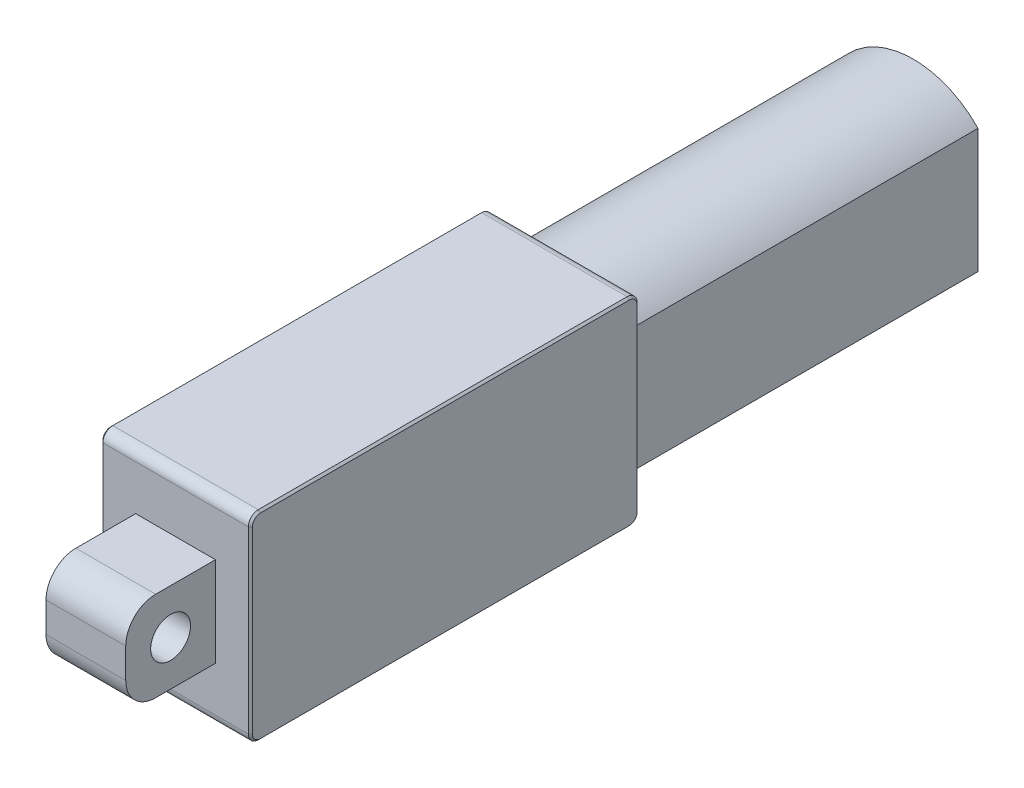
from build123d import *

# Parameters (mm, degrees)
SKETCH_1_R          = 2
EXTRUDE_1_DEPTH     = 8
EXTRUDE_2_DEPTH     = 39
EXTRUDE_3_DEPTH     = 35
SKETCH_4_R          = 4.5
CUT_EXTRUDE_1_DEPTH = 55
FILLET_1_R          = 1
CHAMFER_1_SIZE      = 0.2


with BuildPart() as part:
    # 草图1 → 凸台-拉伸1 (new body)
    with BuildSketch(Plane(origin=(0, 0, 0), x_dir=(0, 0, -1), z_dir=(1, 0, 0))):
        with BuildLine():
            Line((0, 4.5), (4.5, 4.5))
            Line((4.5, 4.5), (4.5, -4.5))
            Line((4.5, -4.5), (-1.5, -4.5))
            ThreePointArc((-1.5, -4.5), (-3.621320344, -3.621320344), (-4.5, -1.5))
            Line((-4.5, -1.5), (-4.5, 1.5))
            ThreePointArc((-4.5, 1.5), (-3.621320344, 3.621320344), (-1.5, 4.5))
            Line((-1.5, 4.5), (0, 4.5))
        make_face()
        Circle(SKETCH_1_R, mode=Mode.SUBTRACT)
    extrude(amount=EXTRUDE_1_DEPTH)

    # 草图2 → 凸台-拉伸2 (add)
    with BuildSketch(Plane(origin=(0, 0, -4.5), x_dir=(-1, 0, 0), z_dir=(0, 0, -1))):
        Polygon((-4, 10), (3.5, 10), (3.5, -10), (-11.5, -10), (-11.5, 10), align=None)
    extrude(amount=EXTRUDE_2_DEPTH)

    # 草图3 → 凸台-拉伸3 (add)
    with BuildSketch(Plane(origin=(0, 0, -43.5), x_dir=(-1, 0, 0), z_dir=(0, 0, -1))):
        with BuildLine():
            Line((2.5, 6.224949799), (2.5, -6.224949799))
            ThreePointArc((2.5, -6.224949799), (-4, -9), (-10.5, -6.224949799))
            Line((-10.5, -6.224949799), (-10.5, 6.224949799))
            ThreePointArc((-10.5, 6.224949799), (-4, 9), (2.5, 6.224949799))
        make_face()
    extrude(amount=EXTRUDE_3_DEPTH)

    # 草图4 → 切除-拉伸1 (cut)
    with BuildSketch(Plane(origin=(0, 0, -78.5), x_dir=(-1, 0, 0), z_dir=(0, 0, -1))):
        with Locations(Location((-4, 0, 0), (0, 0, 90))):
            Circle(SKETCH_4_R)
    extrude(amount=-CUT_EXTRUDE_1_DEPTH, mode=Mode.SUBTRACT)

    # 圆角1
    fillet_1_edges = [part.edges().sort_by_distance(p)[0] for p in [
        (4, -10, -4.5),
        (4, 10, -4.5),
        (4, 10, -43.5),
        (4, -10, -43.5),
    ]]
    fillet(fillet_1_edges, radius=FILLET_1_R - 0.0001)  # a hair under: the kernel refuses the full size

    # 倒角1
    chamfer_1_edges = [part.edges().sort_by_distance(p)[0] for p in [
        (-3.5, -10, -24),
        (11.5, -10, -24),
        (-3.5, 0, -4.5),
        (-3.5, 10, -24),
        (-3.5, 0, -43.5),
        (-3.5, 9.707136071, -4.792863929),
        (-3.5, 9.707136071, -43.207136071),
        (-3.5, -9.707136071, -43.207136071),
        (-3.5, -9.707136071, -4.792863929),
        (11.5, 0, -4.5),
        (11.5, 0, -43.5),
        (11.5, 10, -24),
        (11.5, 9.707136071, -4.792863929),
        (11.5, 9.707136071, -43.207136071),
        (11.5, -9.707136071, -43.207136071),
        (11.5, -9.707136071, -4.792863929),
    ]]
    chamfer(chamfer_1_edges, length=CHAMFER_1_SIZE)


solid = part.part
